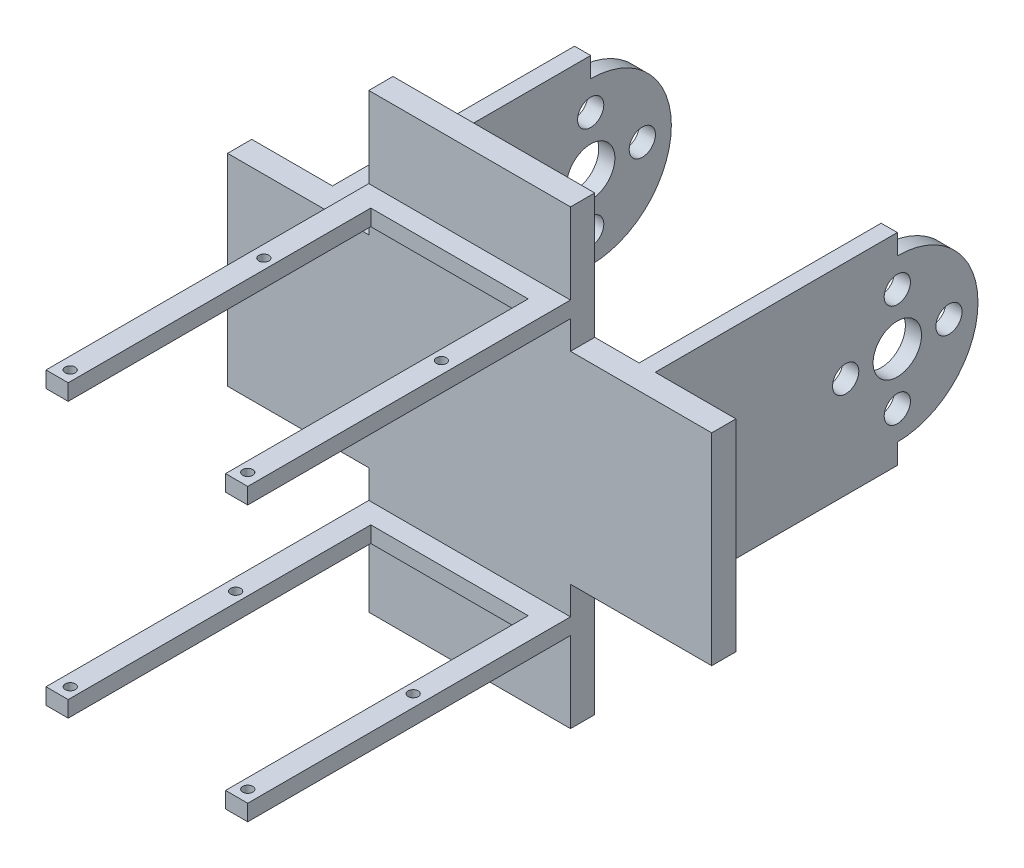
from build123d import *

# Parameters (mm, degrees)
BOSS_EXTRUDE1_DEPTH = 3
SKETCH2_W           = 25
SKETCH2_H           = 2
BOSS_EXTRUDE2_DEPTH = 40
SKETCH3_R           = 0.625
CUT_EXTRUDE1_DEPTH  = 3
SKETCH4_R           = 0.625
CUT_EXTRUDE2_DEPTH  = 3
SKETCH5_W           = 2
SKETCH5_H           = 25
BOSS_EXTRUDE3_DEPTH = 40
SKETCH6_R           = 1.625
SKETCH6_R_2         = 3
CUT_EXTRUDE4_DEPTH  = 40
SKETCH7_W           = 19.5
SKETCH7_H           = 75
CUT_EXTRUDE5_DEPTH  = 40
SKETCH10_W          = 25
SKETCH10_H          = 3
BOSS_EXTRUDE4_DEPTH = 10
SKETCH11_W          = 25
SKETCH11_H          = 3
BOSS_EXTRUDE5_DEPTH = 10
SKETCH12_W          = 3
SKETCH12_H          = 25
BOSS_EXTRUDE6_DEPTH = 10
SKETCH13_W          = 3
SKETCH13_H          = 25
BOSS_EXTRUDE7_DEPTH = 10


with BuildPart() as part:
    # Sketch1 → Boss-Extrude1 (new body)
    with BuildSketch(Plane.XY):
        Polygon((12.5, 12.5), (20, 12.5), (20, -12.5), (12.5, -12.5), (12.5, -18), (-12.5, -18), (-12.5, -12.5), (-20, -12.5), (-20, 12.5), (-12.5, 12.5), (-12.5, 18), (12.5, 18), align=None)
    extrude(amount=BOSS_EXTRUDE1_DEPTH)

    # Sketch2 → Boss-Extrude2 (add)
    with BuildSketch(Plane.XY.offset(3)):
        with Locations((0, 17)):
            Rectangle(SKETCH2_W, SKETCH2_H)
        with Locations((0, -17)):
            Rectangle(SKETCH2_W, SKETCH2_H)
    extrude(amount=BOSS_EXTRUDE2_DEPTH)

    # Sketch3 → Cut-Extrude1 (cut)
    with BuildSketch(Plane(origin=(0, 18, 0), x_dir=(1, 0, 0), z_dir=(0, 1, 0))):
        with Locations((-11, -17.5)):
            Circle(SKETCH3_R)
        with Locations((11, -17.5)):
            Circle(SKETCH3_R)
        with Locations((-11, -41.5)):
            Circle(SKETCH3_R)
        with Locations((11, -41.5)):
            Circle(SKETCH3_R)
    extrude(amount=-CUT_EXTRUDE1_DEPTH, mode=Mode.SUBTRACT)

    # Sketch4 → Cut-Extrude2 (cut)
    with BuildSketch(Plane(origin=(0, -16, 0), x_dir=(1, 0, 0), z_dir=(0, 1, 0))):
        with Locations((-11, -41.5)):
            Circle(SKETCH4_R)
        with Locations((11, -41.5)):
            Circle(SKETCH4_R)
        with Locations((-11, -21)):
            Circle(SKETCH4_R)
        with Locations((11, -21)):
            Circle(SKETCH4_R)
    extrude(amount=-CUT_EXTRUDE2_DEPTH, mode=Mode.SUBTRACT)

    # Sketch5 → Boss-Extrude3 (add)
    with BuildSketch(Plane(origin=(0, 0, 0), x_dir=(-1, 0, 0), z_dir=(0, 0, -1))):
        with Locations((-19, 0)):
            Rectangle(SKETCH5_W, SKETCH5_H)
        with Locations((19, 0)):
            Rectangle(SKETCH5_W, SKETCH5_H)
    extrude(amount=BOSS_EXTRUDE3_DEPTH)

    # Sketch6 → Cut-Extrude4 (cut)
    with BuildSketch(Plane(origin=(20, 0, 0), x_dir=(0, 0, -1), z_dir=(1, 0, 0))):
        with Locations((30, 6.398277061)):
            Circle(SKETCH6_R)
        with Locations((30, 0)):
            Circle(SKETCH6_R_2)
        with Locations((36.398277061, 0)):
            Circle(SKETCH6_R)
        with Locations((30, -6.398277061)):
            Circle(SKETCH6_R)
        with Locations((23.601722939, 0)):
            Circle(SKETCH6_R)
        with BuildLine():
            Line((30, 10), (30, 12.5))
            Line((30, 12.5), (46.457343261, 12.5))
            Line((46.457343261, 12.5), (46.457343261, -12.5))
            Line((46.457343261, -12.5), (30, -12.5))
            Line((30, -12.5), (30, -10))
            ThreePointArc((30, -10), (40, 0), (30, 10))
        make_face()
    extrude(amount=-CUT_EXTRUDE4_DEPTH, mode=Mode.SUBTRACT)

    # Sketch7 → Cut-Extrude5 (cut)
    with BuildSketch(Plane(origin=(0, 18, 0), x_dir=(1, 0, 0), z_dir=(0, 1, 0))):
        with Locations((0, -43)):
            Rectangle(SKETCH7_W, SKETCH7_H)
    extrude(amount=-CUT_EXTRUDE5_DEPTH, mode=Mode.SUBTRACT)

    # Sketch10 → Boss-Extrude4 (add)
    with BuildSketch(Plane(origin=(0, 18, 0), x_dir=(1, 0, 0), z_dir=(0, 1, 0))):
        with Locations((0, -1.5)):
            Rectangle(SKETCH10_W, SKETCH10_H)
    extrude(amount=BOSS_EXTRUDE4_DEPTH)

    # Sketch11 → Boss-Extrude5 (add)
    with BuildSketch(Plane.XZ.offset(18)):
        with Locations((0, 1.5)):
            Rectangle(SKETCH11_W, SKETCH11_H)
    extrude(amount=BOSS_EXTRUDE5_DEPTH)

    # Sketch12 → Boss-Extrude6 (add)
    with BuildSketch(Plane.ZY.offset(20)):
        with Locations((1.5, 0)):
            Rectangle(SKETCH12_W, SKETCH12_H)
    extrude(amount=BOSS_EXTRUDE6_DEPTH)

    # Sketch13 → Boss-Extrude7 (add)
    with BuildSketch(Plane(origin=(20, 0, 0), x_dir=(0, 0, -1), z_dir=(1, 0, 0))):
        with Locations((-1.5, 0)):
            Rectangle(SKETCH13_W, SKETCH13_H)
    extrude(amount=BOSS_EXTRUDE7_DEPTH)


solid = part.part
